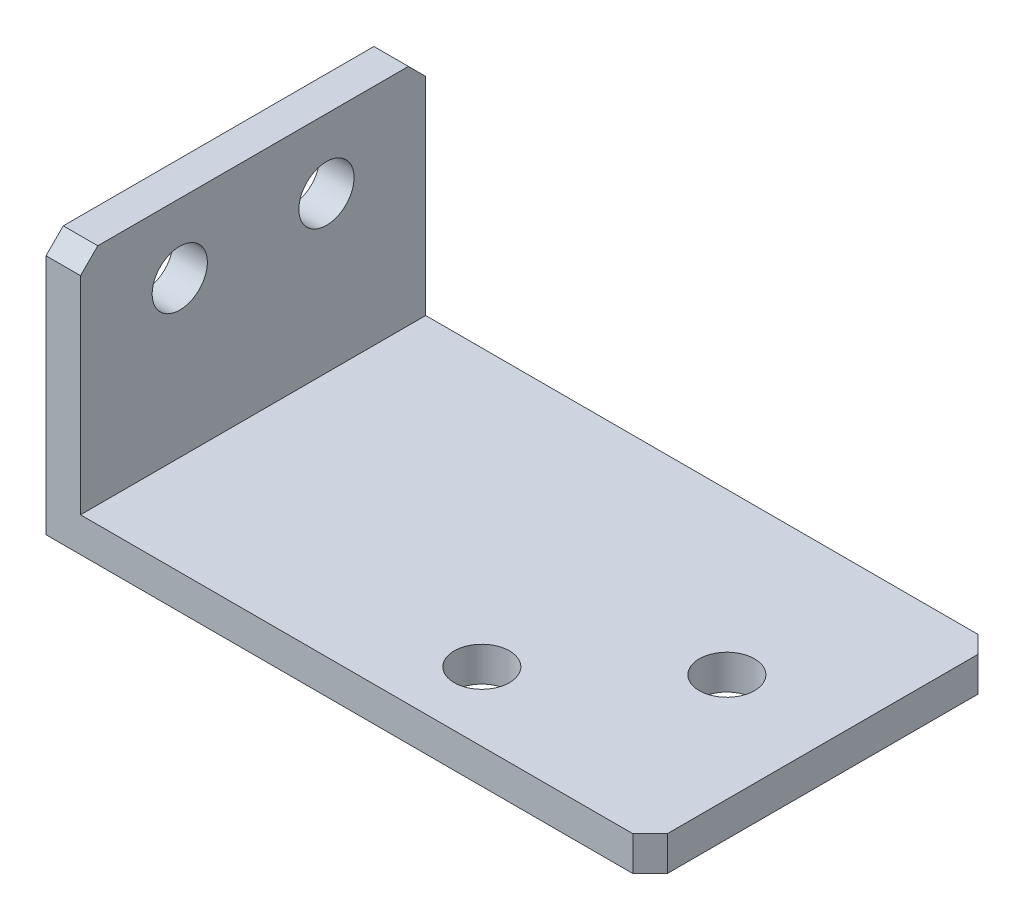
from build123d import *

# Parameters (mm, degrees)
BASE_DEPTH                 = 20
CHAMFER1_SIZE              = 1
F_3_2_3_2_MOUNTSIDE_D      = 3.2
F_3_2_3_2_CABLECHAINSIDE_D = 3.2


with BuildPart() as part:
    # Sketch1 → Base (new body)
    with BuildSketch(Plane.XY):
        Polygon((0, 0), (35, 0), (35, 2), (2, 2), (2, 15), (0, 15), align=None)
    extrude(amount=BASE_DEPTH)

    # Chamfer1
    chamfer1_edges = [part.edges().sort_by_distance(p)[0] for p in [
        (35, 1, 0),
        (1, 15, 0),
        (1, 15, 20),
        (35, 1, 20),
    ]]
    chamfer(chamfer1_edges, length=CHAMFER1_SIZE)

    # Ø3.2 (3.2) MountSide (through all)
    with Locations(Plane.ZY):
        with Locations((5.75, 11), (14.25, 11)):
            Hole(F_3_2_3_2_MOUNTSIDE_D / 2)

    # Ø3.2 (3.2) CableChainSide (through all)
    with Locations(Plane(origin=(0, 0, 0), x_dir=(-1, 0, 0), z_dir=(0, -1, 0))):
        with Locations((-28.75, -9.3), (-21.25, -16)):
            Hole(F_3_2_3_2_CABLECHAINSIDE_D / 2)


solid = part.part
